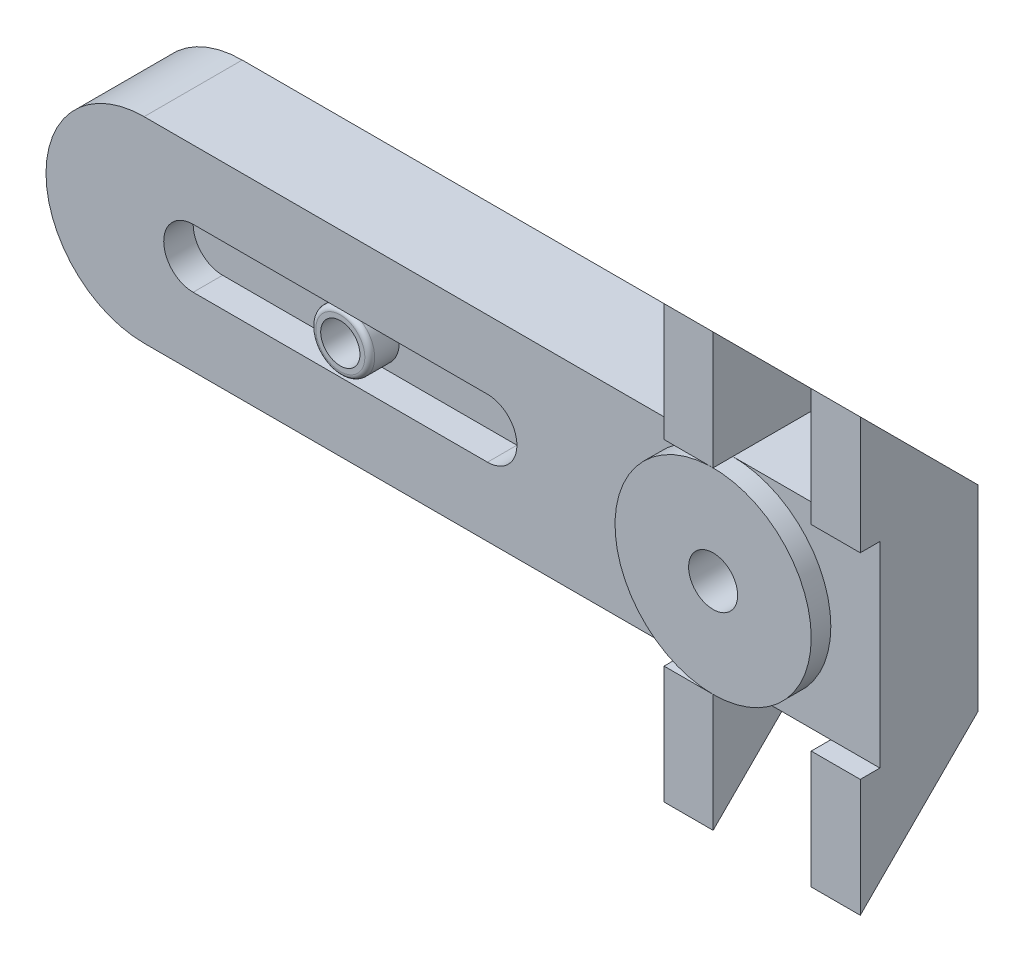
from build123d import *

# Parameters (mm, degrees)
SKETCH1_R             = 2
BOSS_EXTRUDE1_DEPTH   = 2
SKETCH2_R             = 3
SKETCH2_R_2           = 2
BOSS_EXTRUDE2_DEPTH   = 3
FILLET1_R             = 0.5
SKETCH4_W             = 90
SKETCH4_H             = 20
BOSS_EXTRUDE3_DEPTH   = 5
SKETCH5_W             = 90
SKETCH5_H             = 20
BOSS_EXTRUDE6_DEPTH   = 5
FILLET3_R             = 10
FILLET4_R             = 10
FILLET5_R             = 10
FILLET6_R             = 10
SKETCH7_R             = 2.5
CUT_EXTRUDE1_DEPTH    = 10
SKETCH8_R             = 10
SKETCH8_R_2           = 2.5
BOSS_EXTRUDE7_DEPTH   = 2
SKETCH9_W             = 5
SKETCH9_H             = 20
CUT_EXTRUDE2_DEPTH    = 10
BOSS_EXTRUDE8_DEPTH   = 5
SKETCH11_W            = 5
SKETCH11_H            = 12
BOSS_EXTRUDE9_DEPTH   = 12
BOSS_EXTRUDE9_2_DEPTH = 12
CUT_EXTRUDE3_DEPTH    = 12


with BuildPart() as part:
    # Sketch1 → Boss-Extrude1 (new body)
    with BuildSketch(Plane.XY):
        with BuildLine():
            Line((-33.148143839, 5.271469366), (-3.148143839, 5.271469366))
            ThreePointArc((-3.148143839, 5.271469366), (-0.148143839, 2.271469366), (-3.148143839, -0.728530634))
            Line((-3.148143839, -0.728530634), (-33.148143839, -0.728530634))
            ThreePointArc((-33.148143839, -0.728530634), (-36.148143839, 2.271469366), (-33.148143839, 5.271469366))
        make_face()
        with Locations((-18.148143839, 2.271469366)):
            Circle(SKETCH1_R, mode=Mode.SUBTRACT)
    extrude(amount=BOSS_EXTRUDE1_DEPTH)

    # Sketch2 → Boss-Extrude2 (add)
    with BuildSketch(Plane.XY.offset(2)):
        with Locations(Location((-18.148143839, 2.271469366, 0), (0, 0, 270))):
            Circle(SKETCH2_R)
        with Locations((-18.148143839, 2.271469366)):
            Circle(SKETCH2_R_2, mode=Mode.SUBTRACT)
    extrude(amount=BOSS_EXTRUDE2_DEPTH)

    # Fillet1
    fillet1_edges = [part.edges().sort_by_distance(p)[0] for p in [
        (-18.148143839, 5.271469366, 5),
    ]]
    fillet(fillet1_edges, radius=FILLET1_R)


with BuildPart() as body_2:
    # Sketch4 → Boss-Extrude3 (new body)
    with BuildSketch(Plane(origin=(0, 0, 0), x_dir=(-1, 0, 0), z_dir=(0, 0, -1))):
        with Locations((3.148143839, 2.271469366)):
            Rectangle(SKETCH4_W, SKETCH4_H)
        with BuildLine():
            ThreePointArc((33.148143839, -0.728530634), (36.148143839, 2.271469366), (33.148143839, 5.271469366))
            Line((33.148143839, 5.271469366), (3.148143839, 5.271469366))
            ThreePointArc((3.148143839, 5.271469366), (0.148143839, 2.271469366), (3.148143839, -0.728530634))
            Line((3.148143839, -0.728530634), (33.148143839, -0.728530634))
        make_face(mode=Mode.SUBTRACT)
    extrude(amount=-BOSS_EXTRUDE3_DEPTH)

    # Fillet3
    fillet3_edges = [body_2.edges().sort_by_distance(p)[0] for p in [
        (-48.148143839, -7.728530634, 2.5),
    ]]
    fillet(fillet3_edges, radius=FILLET3_R)

    # Fillet6
    fillet6_edges = [body_2.edges().sort_by_distance(p)[0] for p in [
        (-48.148143839, 12.271469366, 2.5),
    ]]
    fillet(fillet6_edges, radius=FILLET6_R - 0.0001)  # a hair under: the kernel refuses the full size


with BuildPart() as body_3:
    # Sketch5 → Boss-Extrude6 (new body)
    with BuildSketch(Plane(origin=(0, 0, 0), x_dir=(-1, 0, 0), z_dir=(0, 0, -1))):
        with Locations((3.148143839, 2.271469366)):
            Rectangle(SKETCH5_W, SKETCH5_H)
    extrude(amount=BOSS_EXTRUDE6_DEPTH)

    # Fillet4
    fillet4_edges = [body_3.edges().sort_by_distance(p)[0] for p in [
        (-48.148143839, -7.728530634, -2.5),
    ]]
    fillet(fillet4_edges, radius=FILLET4_R)

    # Fillet5
    fillet5_edges = [body_3.edges().sort_by_distance(p)[0] for p in [
        (-48.148143839, 12.271469366, -2.5),
    ]]
    fillet(fillet5_edges, radius=FILLET5_R - 0.0001)  # a hair under: the kernel refuses the full size


with BuildPart() as cut_extrude1_tool:
    # Sketch7 → Cut-Extrude1 (new body)
    with BuildSketch(Plane.XY.offset(5)):
        with Locations((21.851856161, 2.271469366)):
            Circle(SKETCH7_R)
    extrude(amount=-CUT_EXTRUDE1_DEPTH)


with BuildPart() as body_2_1:
    add(body_2.part)

    # Cut-Extrude1: cut by cut_extrude1_tool
    add(cut_extrude1_tool.part, mode=Mode.SUBTRACT)

    # Sketch8 → Boss-Extrude7 (add)
    with BuildSketch(Plane.XY.offset(5)):
        with Locations(Location((21.851856161, 2.271469366, 0), (0, 0, 270))):
            Circle(SKETCH8_R)
        with Locations((21.851856161, 2.271469366)):
            Circle(SKETCH8_R_2, mode=Mode.SUBTRACT)
    extrude(amount=BOSS_EXTRUDE7_DEPTH)


with BuildPart() as body_3_1:
    add(body_3.part)

    # Cut-Extrude1: cut by cut_extrude1_tool
    add(cut_extrude1_tool.part, mode=Mode.SUBTRACT)


with BuildPart() as cut_extrude2_tool:
    # Sketch9 → Cut-Extrude2 (new body)
    with BuildSketch(Plane.XY.offset(5)):
        with Locations((39.351856161, 2.271469366)):
            Rectangle(SKETCH9_W, SKETCH9_H)
    extrude(amount=-CUT_EXTRUDE2_DEPTH)


with BuildPart() as body_2_2:
    add(body_2_1.part)

    # Cut-Extrude2: cut by cut_extrude2_tool
    add(cut_extrude2_tool.part, mode=Mode.SUBTRACT)



with BuildPart() as body_3_2:
    add(body_3_1.part)

    # Cut-Extrude2: cut by cut_extrude2_tool
    add(cut_extrude2_tool.part, mode=Mode.SUBTRACT)


with BuildPart() as body_2_3:
    add(body_2_2.part)

    add(body_3_2.part)  # Boss-Extrude8 merges body 3
    # Sketch10 → Boss-Extrude8 (add)
    with BuildSketch(Plane(origin=(36.851856161, 0, 0), x_dir=(0, 0, -1), z_dir=(1, 0, 0))):
        Polygon((5, 12.271469366), (-7, 12.271469366), (-7, 24.271469366), align=None)
        Polygon((5, -7.728530634), (-7, -7.728530634), (-7, -19.728530634), align=None)
    extrude(amount=-BOSS_EXTRUDE8_DEPTH)


with BuildPart() as body_3_2_1:
    # Sketch11 → Boss-Extrude9 (new body)
    with BuildSketch(Plane.XY.offset(7)):
        with Locations((19.351856161, 18.271469366)):
            Rectangle(SKETCH11_W, SKETCH11_H)
    extrude(amount=-BOSS_EXTRUDE9_DEPTH)


with BuildPart() as body_4:
    # Sketch11 → Boss-Extrude9 2 (new body)
    with BuildSketch(Plane.XY.offset(7)):
        with Locations((19.351856161, -13.728530634)):
            Rectangle(SKETCH11_W, SKETCH11_H)
    extrude(amount=-BOSS_EXTRUDE9_2_DEPTH)


with BuildPart() as cut_extrude3_tool:
    # Sketch12 → Cut-Extrude3 (new body)
    with BuildSketch(Plane(origin=(21.851856161, 0, 0), x_dir=(0, 0, -1), z_dir=(1, 0, 0))):
        Polygon((-7, 24.271469366), (5, 24.271469366), (5, 12.271469366), align=None)
        Polygon((5, -7.728530634), (5, -19.728530634), (-7, -19.728530634), align=None)
    extrude(amount=-CUT_EXTRUDE3_DEPTH)


with BuildPart() as body_3_2_2:
    add(body_3_2_1.part)

    # Cut-Extrude3: cut by cut_extrude3_tool
    add(cut_extrude3_tool.part, mode=Mode.SUBTRACT)


with BuildPart() as body_4_1:
    add(body_4.part)

    # Cut-Extrude3: cut by cut_extrude3_tool
    add(cut_extrude3_tool.part, mode=Mode.SUBTRACT)


solid = Compound([part.part, body_2_3.part, body_3_2_2.part, body_4_1.part])
